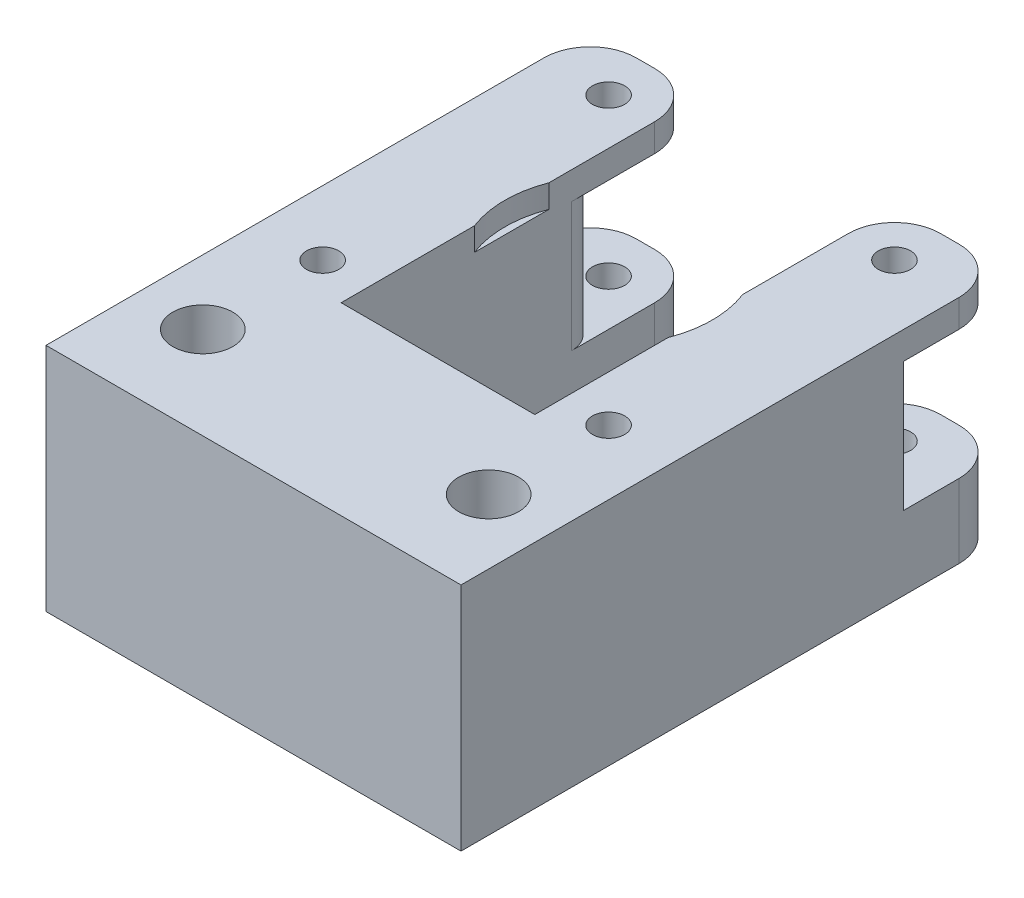
from build123d import *

# Parameters (mm, degrees)
SKETCH1_W                                           = 45
SKETCH1_H                                           = 20
BOSS_EXTRUDE1_DEPTH                                 = 25
SKETCH2_W                                           = 12
SKETCH2_H                                           = 25
BOSS_EXTRUDE2_DEPTH                                 = 40
SKETCH3_R                                           = 1.75
CUT_EXTRUDE1_DEPTH                                  = 61.259853966
SKETCH4_R                                           = 1.75
CUT_EXTRUDE2_DEPTH                                  = 25
CBORE_FOR_M3_HEX_SOCKET_HEAD_CAP_SCREW1_D           = 3.5
CBORE_FOR_M3_HEX_SOCKET_HEAD_CAP_SCREW1_CBORE_D     = 6.5
CBORE_FOR_M3_HEX_SOCKET_HEAD_CAP_SCREW1_CBORE_DEPTH = 11.4
CBORE_FOR_M3_HEX_SOCKET_HEAD_CAP_SCREW2_D           = 3.5
CBORE_FOR_M3_HEX_SOCKET_HEAD_CAP_SCREW2_CBORE_D     = 6.5
CBORE_FOR_M3_HEX_SOCKET_HEAD_CAP_SCREW2_CBORE_DEPTH = 4
CBORE_FOR_M3_PAN_HEAD_SCREW1_D                      = 3.5
CBORE_FOR_M3_PAN_HEAD_SCREW1_CBORE_D                = 6.5
CBORE_FOR_M3_PAN_HEAD_SCREW1_CBORE_DEPTH            = 12.4
CUT_EXTRUDE3_DEPTH                                  = 72.763500472
CUT_EXTRUDE3_DEPTH_BACK                             = 72.763500472
SKETCH9_W                                           = 12
SKETCH9_H                                           = 14
SKETCH10_W                                          = 12
SKETCH10_H                                          = 8
SKETCH10_H_2                                        = 3
CUT_EXTRUDE5_DEPTH                                  = 1
FILLET2_R                                           = 5
FILLET5_R                                           = 3
SKETCH13_R                                          = 11.25
CUT_EXTRUDE6_DEPTH                                  = 2.5


with BuildPart() as part:
    # Sketch1 → Boss-Extrude1 (new body)
    with BuildSketch(Plane(origin=(0, 0, 0), x_dir=(1, 0, 0), z_dir=(0, 1, 0))):
        Rectangle(SKETCH1_W, SKETCH1_H)
    extrude(amount=BOSS_EXTRUDE1_DEPTH)

    # Sketch2 → Boss-Extrude2 (add)
    with BuildSketch(Plane(origin=(0, 0, -10), x_dir=(-1, 0, 0), z_dir=(0, 0, -1))):
        with Locations((-16.5, 12.5)):
            Rectangle(SKETCH2_W, SKETCH2_H)
        with Locations((16.5, 12.5)):
            Rectangle(SKETCH2_W, SKETCH2_H)
    extrude(amount=BOSS_EXTRUDE2_DEPTH)

    # Sketch3 → Cut-Extrude1 (cut, through all)
    with BuildSketch(Plane(origin=(0, 25, 0), x_dir=(1, 0, 0), z_dir=(0, 1, 0))):
        with Locations((15.5, 44)):
            Circle(SKETCH3_R)
        with Locations((15.5, 13)):
            Circle(SKETCH3_R)
        with Locations((-15.5, 13)):
            Circle(SKETCH3_R)
        with Locations((-15.5, 44)):
            Circle(SKETCH3_R)
    extrude(amount=-CUT_EXTRUDE1_DEPTH, mode=Mode.SUBTRACT)

    # Sketch4 → Cut-Extrude2 (cut)
    with BuildSketch(Plane(origin=(0, 25, 0), x_dir=(1, 0, 0), z_dir=(0, 1, 0))):
        with Locations((-15.5, 0)):
            Circle(SKETCH4_R)
        with Locations((15.5, 0)):
            Circle(SKETCH4_R)
    extrude(amount=-CUT_EXTRUDE2_DEPTH, mode=Mode.SUBTRACT)

    # CBORE for M3 Hex Socket Head Cap Screw1 (through all)
    with Locations(Plane(origin=(0, 25, 0), x_dir=(1, 0, 0), z_dir=(0, 1, 0))):
        with Locations((15.5, 0), (-15.5, 0)):
            CounterBoreHole(CBORE_FOR_M3_HEX_SOCKET_HEAD_CAP_SCREW1_D / 2, CBORE_FOR_M3_HEX_SOCKET_HEAD_CAP_SCREW1_CBORE_D / 2, CBORE_FOR_M3_HEX_SOCKET_HEAD_CAP_SCREW1_CBORE_DEPTH)

    # CBORE for M3 Hex Socket Head Cap Screw2 (through all)
    with Locations(Plane(origin=(0, 0, 0), x_dir=(-1, 0, 0), z_dir=(0, -1, 0))):
        with Locations((15.5, 44), (15.5, 13), (-15.5, 13), (-15.5, 44)):
            CounterBoreHole(CBORE_FOR_M3_HEX_SOCKET_HEAD_CAP_SCREW2_D / 2, CBORE_FOR_M3_HEX_SOCKET_HEAD_CAP_SCREW2_CBORE_D / 2, CBORE_FOR_M3_HEX_SOCKET_HEAD_CAP_SCREW2_CBORE_DEPTH)

    # CBORE for M3 Pan Head Screw1 (through all)
    with Locations(Plane(origin=(0, 0, 0), x_dir=(-1, 0, 0), z_dir=(0, -1, 0))):
        with Locations((-15.5, 13), (15.5, 13)):
            CounterBoreHole(CBORE_FOR_M3_PAN_HEAD_SCREW1_D / 2, CBORE_FOR_M3_PAN_HEAD_SCREW1_CBORE_D / 2, CBORE_FOR_M3_PAN_HEAD_SCREW1_CBORE_DEPTH)

    # Sketch9 → Cut-Extrude3 (cut, two sides: drawn at the far end of the back side and taken through both)
    with BuildSketch(Plane(origin=(22.5, 0, 0), x_dir=(0, 0, -1), z_dir=(1, 0, 0)).offset(-CUT_EXTRUDE3_DEPTH_BACK)):
        with Locations((44, 15)):
            Rectangle(SKETCH9_W, SKETCH9_H)
    extrude(amount=CUT_EXTRUDE3_DEPTH + CUT_EXTRUDE3_DEPTH_BACK, mode=Mode.SUBTRACT)

    # Sketch10 → Cut-Extrude5 (cut)
    with BuildSketch(Plane(origin=(0, 0, -50), x_dir=(-1, 0, 0), z_dir=(0, 0, -1))):
        with Locations((-16.5, 4)):
            Rectangle(SKETCH10_W, SKETCH10_H)
        with Locations((16.5, 4)):
            Rectangle(SKETCH10_W, SKETCH10_H)
        with Locations((-16.5, 23.5)):
            Rectangle(SKETCH10_W, SKETCH10_H_2)
        with Locations((16.5, 23.5)):
            Rectangle(SKETCH10_W, SKETCH10_H_2)
    extrude(amount=-CUT_EXTRUDE5_DEPTH, mode=Mode.SUBTRACT)

    # Fillet2
    fillet2_edges = [part.edges().sort_by_distance(p)[0] for p in [
        (-10.5, 4, -49),
        (10.5, 4, -49),
        (-10.5, 23.5, -49),
        (10.5, 23.5, -49),
        (-22.5, 23.5, -49),
        (-22.5, 4, -49),
        (22.5, 4, -49),
        (22.5, 23.5, -49),
    ]]
    fillet(fillet2_edges, radius=FILLET2_R)

    # Fillet5
    fillet5_edges = [part.edges().sort_by_distance(p)[0] for p in [
        (-10.5, 15, -38),
        (10.5, 15, -38),
    ]]
    fillet(fillet5_edges, radius=FILLET5_R)

    # Sketch13 → Cut-Extrude6 (cut)
    with BuildSketch(Plane(origin=(0, 25, 0), x_dir=(1, 0, 0), z_dir=(0, 1, 0))):
        with Locations((0, 28.5)):
            Circle(SKETCH13_R)
    extrude(amount=-CUT_EXTRUDE6_DEPTH, mode=Mode.SUBTRACT)


solid = part.part
